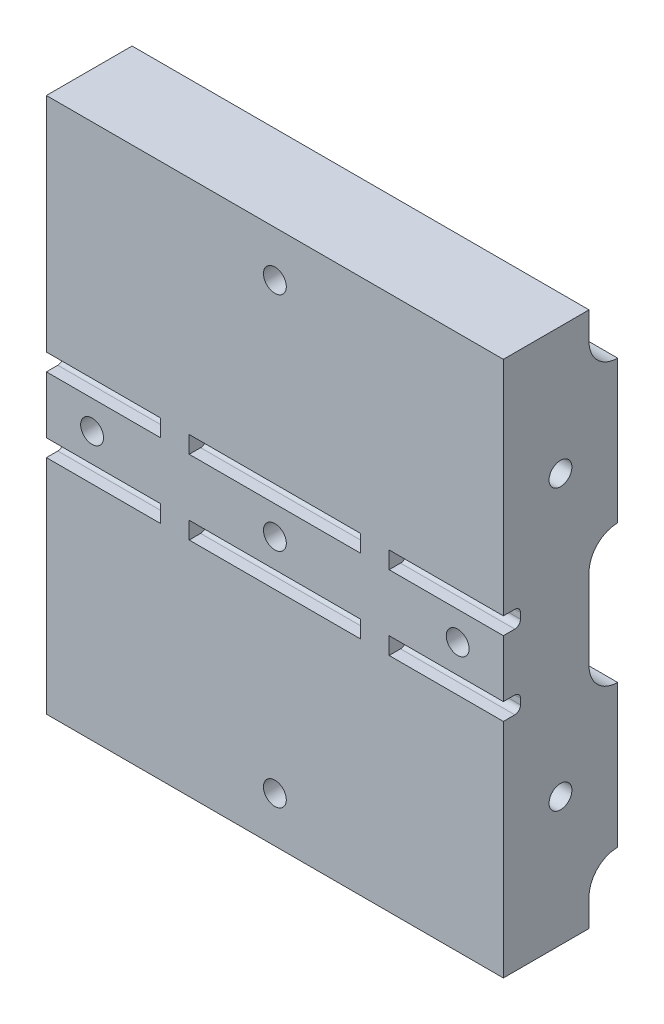
from build123d import *

# Parameters (mm, degrees)
SKETCH1_W           = 80
SKETCH1_H           = 93.8
BOSS_EXTRUDE1_DEPTH = 15
SKETCH2_W           = 10
SKETCH2_H           = 15
CUT_EXTRUDE1_DEPTH  = 10
SKETCH3_R           = 2
CUT_EXTRUDE2_DEPTH  = 94.939395357
SKETCH4_W           = 20
SKETCH4_H           = 25
SKETCH4_W_2         = 10
SKETCH4_H_2         = 15
BOSS_EXTRUDE2_DEPTH = 5
FILLET1_R           = 5
SKETCH5_R           = 2
CUT_EXTRUDE3_DEPTH  = 2.5
SKETCH6_W           = 3
SKETCH6_H           = 3
CUT_EXTRUDE4_DEPTH  = 94.939395357
SKETCH7_R           = 2
CUT_EXTRUDE5_DEPTH  = 3.2
SKETCH8_R           = 2
CUT_EXTRUDE6_DEPTH  = 64.439813997
CUT_EXTRUDE7_REACH  = 66.804
SKETCH9_W           = 10.4
SKETCH9_H           = 15.4
SKETCH10_R          = 3.5
CUT_EXTRUDE8_DEPTH  = 4
SKETCH11_R          = 2
CUT_EXTRUDE9_DEPTH  = 64.439813997
FILLET3_R           = 1
SKETCH12_W          = 5
SKETCH12_H          = 20
BOSS_EXTRUDE4_DEPTH = 5


with BuildPart() as part:
    # Sketch1 → Boss-Extrude1 (new body)
    with BuildSketch(Plane.XY):
        Rectangle(SKETCH1_W, SKETCH1_H)
    extrude(amount=BOSS_EXTRUDE1_DEPTH)

    # Sketch2 → Cut-Extrude1 (cut)
    with BuildSketch(Plane(origin=(0, 0, 0), x_dir=(-1, 0, 0), z_dir=(0, 0, -1))):
        with Locations((30, -24.4)):
            Rectangle(SKETCH2_W, SKETCH2_H)
        with Locations((-30, -24.4)):
            Rectangle(SKETCH2_W, SKETCH2_H)
        with Locations((30, 24.584880812)):
            Rectangle(SKETCH2_W, SKETCH2_H)
        with Locations((-30, 24.584880812)):
            Rectangle(SKETCH2_W, SKETCH2_H)
    extrude(amount=-CUT_EXTRUDE1_DEPTH, mode=Mode.SUBTRACT)

    # Sketch3 → Cut-Extrude2 (cut, through all)
    with BuildSketch(Plane(origin=(40, 0, 0), x_dir=(0, 0, -1), z_dir=(1, 0, 0))):
        with Locations((-5, 24.584880812)):
            Circle(SKETCH3_R)
        with Locations((-5, -24.4)):
            Circle(SKETCH3_R)
    extrude(amount=-CUT_EXTRUDE2_DEPTH, mode=Mode.SUBTRACT)

    # Sketch4 → Boss-Extrude2 (add)
    # profile 1 of 4: a face of its own
    with BuildSketch(Plane(origin=(0, 0, 0), x_dir=(-1, 0, 0), z_dir=(0, 0, -1))):
        with Locations((-30, 24.584880812)):
            Rectangle(SKETCH4_W, SKETCH4_H)
        with Locations((-30, 24.584880812)):
            Rectangle(SKETCH4_W_2, SKETCH4_H_2, mode=Mode.SUBTRACT)
    # profile 2 of 4: a face of its own
    with BuildSketch(Plane(origin=(0, 0, 0), x_dir=(-1, 0, 0), z_dir=(0, 0, -1))):
        with Locations((30, 24.584880812)):
            Rectangle(SKETCH4_W, SKETCH4_H)
        with Locations((30, 24.584880812)):
            Rectangle(SKETCH4_W_2, SKETCH4_H_2, mode=Mode.SUBTRACT)
    # profile 3 of 4: a face of its own
    with BuildSketch(Plane(origin=(0, 0, 0), x_dir=(-1, 0, 0), z_dir=(0, 0, -1))):
        with Locations((30, -24.584880812)):
            Rectangle(SKETCH4_W, SKETCH4_H)
        with Locations((30, -24.584880812)):
            Rectangle(SKETCH4_W_2, SKETCH4_H_2, mode=Mode.SUBTRACT)
    # profile 4 of 4: a face of its own
    with BuildSketch(Plane(origin=(0, 0, 0), x_dir=(-1, 0, 0), z_dir=(0, 0, -1))):
        with Locations((-30, -24.584880812)):
            Rectangle(SKETCH4_W, SKETCH4_H)
        with Locations((-30, -24.584880812)):
            Rectangle(SKETCH4_W_2, SKETCH4_H_2, mode=Mode.SUBTRACT)
    extrude(amount=BOSS_EXTRUDE2_DEPTH)

    # Fillet1
    fillet1_edges = [part.edges().sort_by_distance(p)[0] for p in [
        (-30, -37.084880812, 0),
        (30, -37.084880812, 0),
        (-30, -12.084880812, 0),
        (30, -12.084880812, 0),
        (-30, 37.084880812, 0),
        (30, 37.084880812, 0),
        (-30, 12.084880812, 0),
        (30, 12.084880812, 0),
        (20, 24.584880812, 0),
        (-20, 24.584880812, 0),
        (-20, -24.584880812, 0),
        (20, -24.584880812, 0),
    ]]
    fillet(fillet1_edges, radius=FILLET1_R - 0.0001)  # a hair under: the kernel refuses the full size

    # Sketch5 → Cut-Extrude3 (cut)
    with BuildSketch(Plane(origin=(0, 0, 0), x_dir=(-1, 0, 0), z_dir=(0, 0, -1))):
        with Locations((0, -26.9)):
            Circle(SKETCH5_R)
        with Locations((0, 27.08)):
            Circle(SKETCH5_R)
    extrude(amount=-CUT_EXTRUDE3_DEPTH, mode=Mode.SUBTRACT)

    # Sketch6 → Cut-Extrude4 (cut, through all)
    with BuildSketch(Plane(origin=(40, 0, 0), x_dir=(0, 0, -1), z_dir=(1, 0, 0))):
        with Locations((-13.5, 6.5)):
            Rectangle(SKETCH6_W, SKETCH6_H)
        with Locations((-13.5, -6.5)):
            Rectangle(SKETCH6_W, SKETCH6_H)
    extrude(amount=-CUT_EXTRUDE4_DEPTH, mode=Mode.SUBTRACT)

    # Sketch7 → Cut-Extrude5 (cut)
    # profile 1 of 4: a face of its own
    with BuildSketch(Plane(origin=(0, 0, 0), x_dir=(-1, 0, 0), z_dir=(0, 0, -1))):
        Polygon((-2.000518683, -42.365), (-4.001037365, -38.9), (-2.000518683, -35.435), (2.000518683, -35.435), (4.001037365, -38.9), (2.000518683, -42.365), align=None)
        with Locations(Location((0, -38.9, 0), (0, 0, 180))):
            Circle(SKETCH7_R, mode=Mode.SUBTRACT)
    # profile 2 of 4: a face of its own
    with BuildSketch(Plane(origin=(0, 0, 0), x_dir=(-1, 0, 0), z_dir=(0, 0, -1))):
        Polygon((28.004736137, 0), (30.002368069, -3.46), (33.997631931, -3.46), (35.995263863, 0), (33.997631931, 3.46), (30.002368069, 3.46), align=None)
        with Locations((32, 0)):
            Circle(SKETCH7_R, mode=Mode.SUBTRACT)
    # profile 3 of 4: a face of its own
    with BuildSketch(Plane(origin=(0, 0, 0), x_dir=(-1, 0, 0), z_dir=(0, 0, -1))):
        Polygon((-4.001037365, 38.9), (-2.000518683, 35.435), (2.000518683, 35.435), (4.001037365, 38.9), (2.000518683, 42.365), (-2.000518683, 42.365), align=None)
        with Locations((0, 38.9)):
            Circle(SKETCH7_R, mode=Mode.SUBTRACT)
    # profile 4 of 4: a face of its own
    with BuildSketch(Plane(origin=(0, 0, 0), x_dir=(-1, 0, 0), z_dir=(0, 0, -1))):
        Polygon((-30.002368069, 3.46), (-28.004736137, 0), (-30.002368069, -3.46), (-33.997631931, -3.46), (-35.995263863, 0), (-33.997631931, 3.46), align=None)
        with Locations(Location((-32, 0, 0), (0, 0, 180))):
            Circle(SKETCH7_R, mode=Mode.SUBTRACT)
    extrude(amount=-CUT_EXTRUDE5_DEPTH, mode=Mode.SUBTRACT)

    # Sketch8 → Cut-Extrude6 (cut, through all)
    with BuildSketch(Plane(origin=(0, 0, 0), x_dir=(-1, 0, 0), z_dir=(0, 0, -1))):
        with Locations((-32, 0)):
            Circle(SKETCH8_R)
        with Locations((0, -38.9)):
            Circle(SKETCH8_R)
        with Locations((32, 0)):
            Circle(SKETCH8_R)
        with Locations((0, 38.9)):
            Circle(SKETCH8_R)
    extrude(amount=-CUT_EXTRUDE6_DEPTH, mode=Mode.SUBTRACT)

    # Cut-Extrude7: up to this face of the body (flat: up to its plane)
    cut_extrude7_end = Plane(part.part.faces().sort_by_distance((30, 24.584880812, 10))[0])
    # Sketch9 → Cut-Extrude7 (cut, up to the picked face)
    with BuildSketch(Plane(origin=(0, 0, -5), x_dir=(-1, 0, 0), z_dir=(0, 0, -1)), mode=Mode.PRIVATE) as cut_extrude7_sk1:
        with Locations((-30, 24.584880812)):
            Rectangle(SKETCH9_W, SKETCH9_H)
    cut_extrude7_tool1 = split(extrude(cut_extrude7_sk1.sketch, amount=-CUT_EXTRUDE7_REACH, mode=Mode.PRIVATE), bisect_by=cut_extrude7_end, keep=Keep.BOTH, mode=Mode.PRIVATE)
    # Sketch9 → Cut-Extrude7 (cut, up to the picked face)
    with BuildSketch(Plane(origin=(0, 0, -5), x_dir=(-1, 0, 0), z_dir=(0, 0, -1)), mode=Mode.PRIVATE) as cut_extrude7_sk2:
        with Locations((30, 24.584880812)):
            Rectangle(SKETCH9_W, SKETCH9_H)
    cut_extrude7_tool2 = split(extrude(cut_extrude7_sk2.sketch, amount=-CUT_EXTRUDE7_REACH, mode=Mode.PRIVATE), bisect_by=cut_extrude7_end, keep=Keep.BOTH, mode=Mode.PRIVATE)
    # Sketch9 → Cut-Extrude7 (cut, up to the picked face)
    with BuildSketch(Plane(origin=(0, 0, -5), x_dir=(-1, 0, 0), z_dir=(0, 0, -1)), mode=Mode.PRIVATE) as cut_extrude7_sk3:
        with Locations((30, -24.584880812)):
            Rectangle(SKETCH9_W, SKETCH9_H)
    cut_extrude7_tool3 = split(extrude(cut_extrude7_sk3.sketch, amount=-CUT_EXTRUDE7_REACH, mode=Mode.PRIVATE), bisect_by=cut_extrude7_end, keep=Keep.BOTH, mode=Mode.PRIVATE)
    # Sketch9 → Cut-Extrude7 (cut, up to the picked face)
    with BuildSketch(Plane(origin=(0, 0, -5), x_dir=(-1, 0, 0), z_dir=(0, 0, -1)), mode=Mode.PRIVATE) as cut_extrude7_sk4:
        with Locations((-30, -24.584880812)):
            Rectangle(SKETCH9_W, SKETCH9_H)
    cut_extrude7_tool4 = split(extrude(cut_extrude7_sk4.sketch, amount=-CUT_EXTRUDE7_REACH, mode=Mode.PRIVATE), bisect_by=cut_extrude7_end, keep=Keep.BOTH, mode=Mode.PRIVATE)
    add(cut_extrude7_tool1.solids().sort_by(Axis((30, 24.584881, -5), (0, 0, 1)))[0], mode=Mode.SUBTRACT)
    add(cut_extrude7_tool2.solids().sort_by(Axis((-30, 24.584881, -5), (0, 0, 1)))[0], mode=Mode.SUBTRACT)
    add(cut_extrude7_tool3.solids().sort_by(Axis((-30, -24.584881, -5), (0, 0, 1)))[0], mode=Mode.SUBTRACT)
    add(cut_extrude7_tool4.solids().sort_by(Axis((30, -24.584881, -5), (0, 0, 1)))[0], mode=Mode.SUBTRACT)

    # Sketch10 → Cut-Extrude8 (cut)
    with BuildSketch(Plane(origin=(0, 0, 0), x_dir=(-1, 0, 0), z_dir=(0, 0, -1))):
        Circle(SKETCH10_R)
    extrude(amount=-CUT_EXTRUDE8_DEPTH, mode=Mode.SUBTRACT)

    # Sketch11 → Cut-Extrude9 (cut, through all)
    with BuildSketch(Plane(origin=(0, 0, 0), x_dir=(-1, 0, 0), z_dir=(0, 0, -1))):
        Circle(SKETCH11_R)
    extrude(amount=-CUT_EXTRUDE9_DEPTH, mode=Mode.SUBTRACT)

    # Fillet3
    fillet3_edges = [part.edges().sort_by_distance(p)[0] for p in [
        (0, 8, 12),
        (0, 5, 12),
        (0, -5, 12),
        (0, -8, 12),
    ]]
    fillet(fillet3_edges, radius=FILLET3_R)

    # Sketch12 → Boss-Extrude4 (add)
    with BuildSketch(Plane.XY.offset(15)):
        with Locations((-17.5, -0.1)):
            Rectangle(SKETCH12_W, SKETCH12_H)
        with Locations((17.5, -0.1)):
            Rectangle(SKETCH12_W, SKETCH12_H)
    extrude(amount=-BOSS_EXTRUDE4_DEPTH)


solid = part.part
